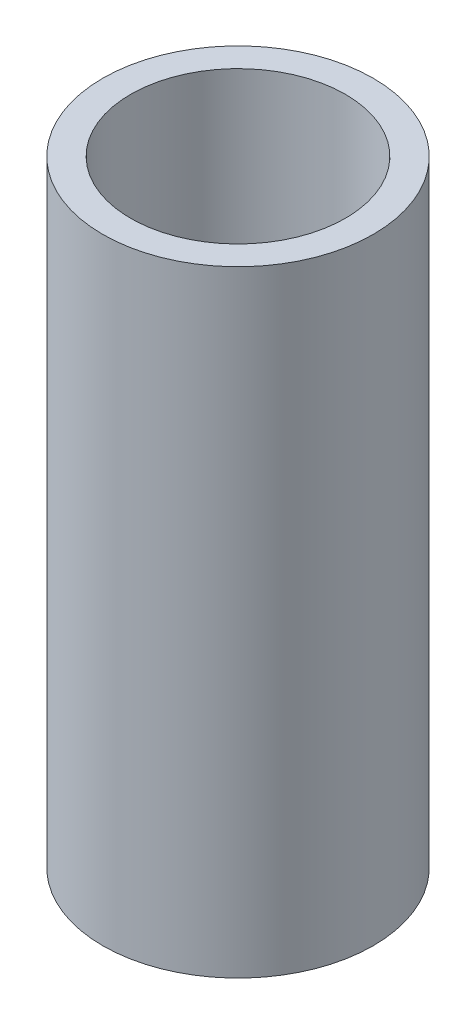
from build123d import *

# Parameters (mm, degrees)
SKETCH1_R           = 25
BOSS_EXTRUDE1_DEPTH = 113.87975564
SKETCH2_R           = 19.855411249
CUT_EXTRUDE1_DEPTH  = 120.241765941


with BuildPart() as part:
    # Sketch1 → Boss-Extrude1 (new body)
    with BuildSketch(Plane(origin=(0, 0, 0), x_dir=(1, 0, 0), z_dir=(0, 1, 0))):
        Circle(SKETCH1_R)
    extrude(amount=BOSS_EXTRUDE1_DEPTH)

    # Sketch2 → Cut-Extrude1 (cut, through all)
    with BuildSketch(Plane(origin=(0, 0, 0), x_dir=(1, 0, 0), z_dir=(0, 1, 0))):
        Circle(SKETCH2_R)
    extrude(amount=CUT_EXTRUDE1_DEPTH, mode=Mode.SUBTRACT)


solid = part.part
